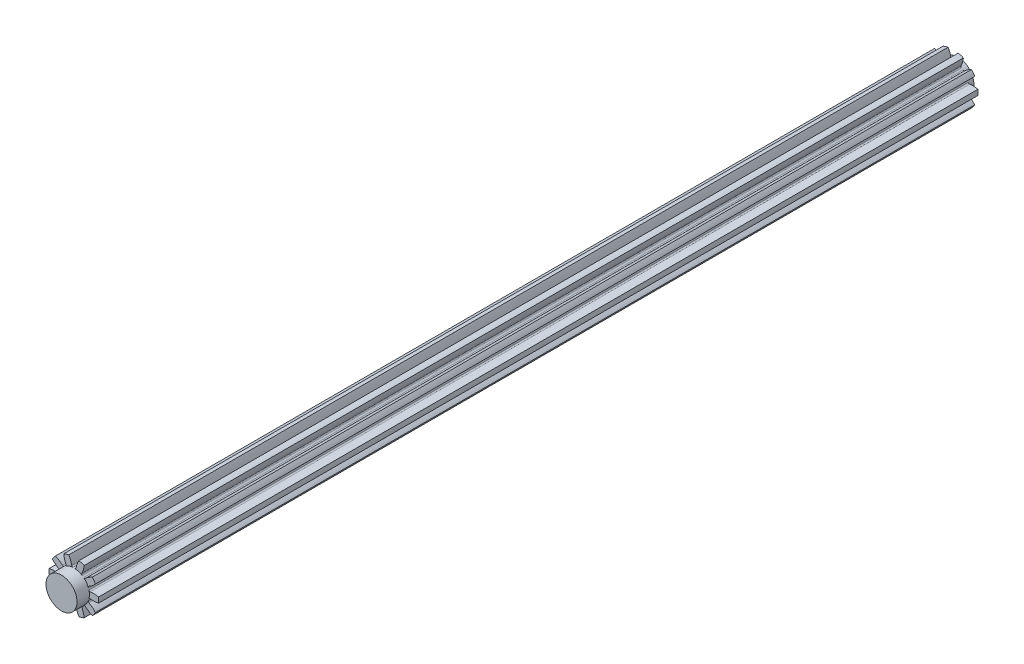
from build123d import *

# Parameters (mm, degrees)
SKETCH1_R                = 12
BOSS_EXTRUDE1_DEPTH      = 212.5
CUT_EXTRUDE1_DEPTH       = 214.176570007
FILLET1_R                = 0.6
FILLET2_R                = 0.6
CIRPATTERN2_COUNT        = 10
FILLET1_OF_CIRPATTERN2_R = 0.6
FILLET2_OF_CIRPATTERN2_R = 0.6
SKETCH4_R                = 7.5
SKETCH4_R_2              = 3
BOSS_EXTRUDE2_DEPTH      = 2.5
CUT_EXTRUDE2_DEPTH       = 426.331666762
CUT_EXTRUDE2_DEPTH_BACK  = 32
SKETCH5_R                = 3
SKETCH6_R                = 7.5
BOSS_EXTRUDE3_DEPTH      = 6


with BuildPart() as part:
    # Sketch1 → Boss-Extrude1 (new, symmetric)
    with BuildSketch(Plane.XY):
        Circle(SKETCH1_R)
    extrude(amount=BOSS_EXTRUDE1_DEPTH, both=True)

    # Sketch2 → Cut-Extrude1 (cut, symmetric)
    with BuildSketch(Plane.XY):
        with BuildLine():
            ThreePointArc((-3.025362823, 12.643068448), (-1.674613805, 10.167523315), (-0.969059762, 7.437131381))
            ThreePointArc((-0.969059762, 7.437131381), (0, 7.5), (0.969059762, 7.437131381))
            ThreePointArc((0.969059762, 7.437131381), (1.674613805, 10.167523315), (3.025362823, 12.643068448))
            ThreePointArc((3.025362823, 12.643068448), (0, 13), (-3.025362823, 12.643068448))
        make_face()
    cut_extrude1 = extrude(amount=CUT_EXTRUDE1_DEPTH, both=True, mode=Mode.SUBTRACT)

    # Fillet1
    fillet1_edges = [part.edges().sort_by_distance(p)[0] for p in [
        (-0.969059762, 7.437131381, 0),
    ]]
    fillet(fillet1_edges, radius=FILLET1_R)

    # Fillet2
    fillet2_edges = [part.edges().sort_by_distance(p)[0] for p in [
        (0.969059762, 7.437131381, 0),
    ]]
    fillet(fillet2_edges, radius=FILLET2_R)

    # CirPattern2: Cut-Extrude1 ×10 about axis
    cirpattern2_axis = Axis((0, 0, 212.5), (0, 0, 1))
    for i in range(1, CIRPATTERN2_COUNT):
        add(cut_extrude1.rotate(cirpattern2_axis, i * 360 / CIRPATTERN2_COUNT), mode=Mode.SUBTRACT)

    # Fillet1 of CirPattern2
    fillet1_of_cirpattern2_edges = [part.edges().sort_by_distance(p)[0] for p in [
        (-5.155421961, 5.44716664, 0),
        (-7.372588197, 1.376569385, 0),
        (-6.773676327, -3.219830588, 0),
        (-3.587450329, -6.586364713, 0),
        (0.969059762, -7.437131381, 0),
        (5.155421961, -5.44716664, 0),
        (7.372588197, -1.376569385, 0),
        (6.773676327, 3.219830588, 0),
        (3.587450329, 6.586364713, 0),
    ]]
    fillet(fillet1_of_cirpattern2_edges, radius=FILLET1_OF_CIRPATTERN2_R)

    # Fillet2 of CirPattern2
    fillet2_of_cirpattern2_edges = [part.edges().sort_by_distance(p)[0] for p in [
        (-3.587450329, 6.586364713, 0),
        (-6.773676327, 3.219830588, 0),
        (-7.372588197, -1.376569385, 0),
        (-5.155421961, -5.44716664, 0),
        (-0.969059762, -7.437131381, 0),
        (3.587450329, -6.586364713, 0),
        (6.773676327, -3.219830588, 0),
        (7.372588197, 1.376569385, 0),
        (5.155421961, 5.44716664, 0),
    ]]
    fillet(fillet2_of_cirpattern2_edges, radius=FILLET2_OF_CIRPATTERN2_R)

    # Sketch4 → Boss-Extrude2 (add, symmetric)
    with BuildSketch(Plane(origin=(0, 0, -212.5), x_dir=(-1, 0, 0), z_dir=(0, 0, -1))):
        Circle(SKETCH4_R)
        Circle(SKETCH4_R_2, mode=Mode.SUBTRACT)
    extrude(amount=BOSS_EXTRUDE2_DEPTH, both=True)

    # Sketch5 → Cut-Extrude2 (cut, two sides: drawn at the far end of the back side and taken through both)
    with BuildSketch(Plane(origin=(0, 0, -212.5), x_dir=(-1, 0, 0), z_dir=(0, 0, -1)).offset(-CUT_EXTRUDE2_DEPTH_BACK)):
        Circle(SKETCH5_R)
    extrude(amount=CUT_EXTRUDE2_DEPTH + CUT_EXTRUDE2_DEPTH_BACK, mode=Mode.SUBTRACT)

    # Sketch6 → Boss-Extrude3 (add, symmetric)
    with BuildSketch(Plane.XY.offset(212.5)):
        Circle(SKETCH6_R)
    extrude(amount=BOSS_EXTRUDE3_DEPTH, both=True)


solid = part.part
